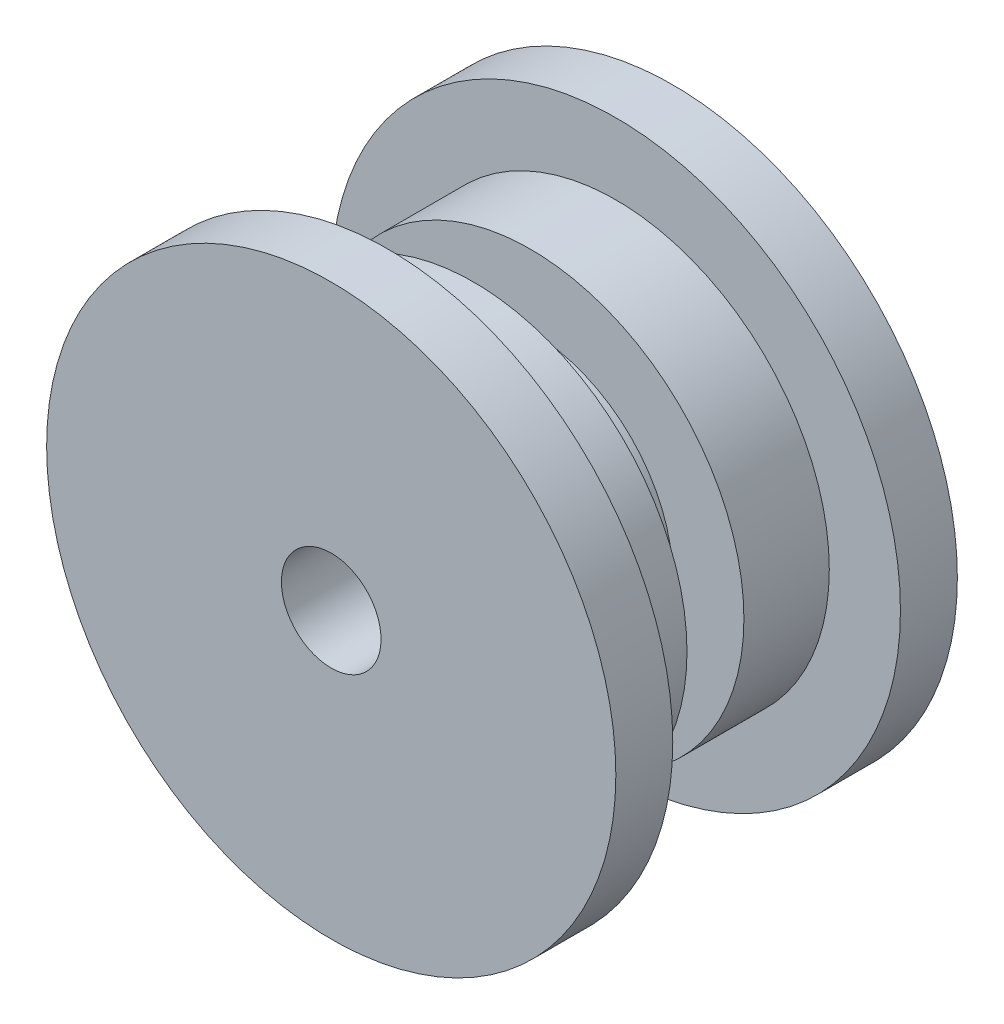
from build123d import *

# Parameters (mm, degrees)
SKETCH_1_R          = 10
EXTRUDE_1_DEPTH     = 2
SKETCH_2_R          = 7.5
EXTRUDE_2_DEPTH     = 3
SKETCH_3_R          = 5
EXTRUDE_3_DEPTH     = 2
SKETCH_4_R          = 7.5
EXTRUDE_4_DEPTH     = 3
SKETCH_5_R          = 10
EXTRUDE_5_DEPTH     = 2
SKETCH_6_R          = 1.75
CUT_EXTRUDE_1_DEPTH = 22


with BuildPart() as part:
    # 草图1 → 凸台-拉伸1 (new body)
    with BuildSketch(Plane.XY):
        Circle(SKETCH_1_R)
    extrude(amount=EXTRUDE_1_DEPTH)

    # 草图2 → 凸台-拉伸2 (add)
    with BuildSketch(Plane.XY.offset(2)):
        Circle(SKETCH_2_R)
    extrude(amount=EXTRUDE_2_DEPTH)

    # 草图3 → 凸台-拉伸3 (add)
    with BuildSketch(Plane.XY.offset(5)):
        Circle(SKETCH_3_R)
    extrude(amount=EXTRUDE_3_DEPTH)

    # 草图4 → 凸台-拉伸4 (add)
    with BuildSketch(Plane.XY.offset(7)):
        Circle(SKETCH_4_R)
    extrude(amount=EXTRUDE_4_DEPTH)

    # 草图5 → 凸台-拉伸5 (add)
    with BuildSketch(Plane.XY.offset(10)):
        Circle(SKETCH_5_R)
    extrude(amount=EXTRUDE_5_DEPTH)

    # 草图6 → 切除-拉伸1 (cut)
    with BuildSketch(Plane(origin=(0, 0, 0), x_dir=(-1, 0, 0), z_dir=(0, 0, -1))):
        Circle(SKETCH_6_R)
    extrude(amount=-CUT_EXTRUDE_1_DEPTH, mode=Mode.SUBTRACT)


solid = part.part
